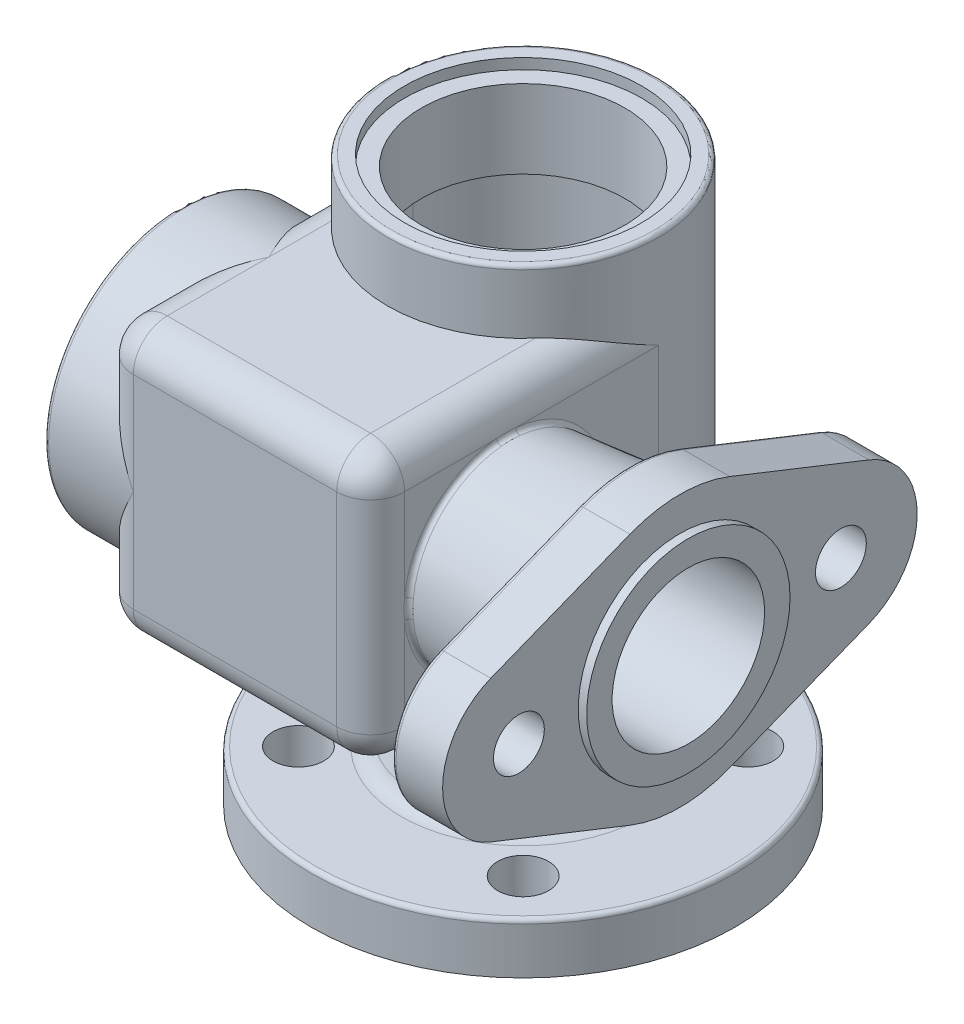
from build123d import *

# Parameters (mm, degrees)
EXTRUDE_1_REACH             = 169.693
EXTRUDE_1_END_RADIUS        = 32
SKETCH_2_W                  = 64
SKETCH_2_H                  = 64
EXTRUDE_1_DIRECTION_2_DEPTH = 32
FILLET_1_R                  = 8
FILLET_2_R                  = 8
SKETCH_4_R                  = 26
SKETCH_3_R                  = 23
EXTRUDE_2_DEPTH             = 12
SKETCH_6_R                  = 24
EXTRUDE_3_DEPTH             = 2
CUT_EXTRUDE_1_REACH         = 206.494
SKETCH_7_R                  = 6
SKETCH_8_R                  = 18
CUT_EXTRUDE_2_DEPTH         = 53
CUT_EXTRUDE_3_DEPTH         = 52
SKETCH_10_R                 = 28
CUT_EXTRUDE_4_DEPTH         = 2.5
CUT_EXTRUDE_5_REACH         = 179.891
SKETCH_11_R                 = 24
SKETCH_12_R                 = 12.5
CUT_EXTRUDE_6_DEPTH         = 39
SKETCH_13_R                 = 18
CUT_EXTRUDE_7_DEPTH         = 10
EXTRUDE_4_REACH             = 204.704
SKETCH_15_R                 = 32
SKETCH_16_R                 = 24
CUT_EXTRUDE_8_DEPTH         = 4
CUT_EXTRUDE_9_REACH         = 202.362
SKETCH_17_R                 = 19.5
SKETCH_18_R                 = 6
CUT_EXTRUDE_10_DEPTH        = 170.499262535
PATTERN_CIRCULAR_1_COUNT    = 4
FILLET_3_R                  = 1
FILLET_4_R                  = 1
CUT_EXTRUDE_11_REACH        = 141.348
SKETCH_19_R                 = 16.5


with BuildPart() as part:
    # 草圖1 → 旋轉1 (revolve)
    with BuildSketch(Plane.XY, mode=Mode.PRIVATE) as revolve_1_sk:
        with BuildLine():
            Line((0, 0), (30, 0))
            Line((30, 0), (30, 2))
            Line((30, 2), (50, 2))
            Line((50, 2), (50, 13))
            ThreePointArc((50, 13), (49.707106781, 13.707106781), (49, 14))
            Line((49, 14), (28.772001873, 14))
            ThreePointArc((28.772001873, 14), (26.493622522, 14.71229753), (25.026685162, 16.595506234))
            Line((25.026685162, 16.595506234), (20.973673426, 27.403537532))
            ThreePointArc((20.973673426, 27.403537532), (20.822133836, 29.710533915), (21.972435676, 31.716026931))
            ThreePointArc((21.972435676, 31.716026931), (29.386373897, 42.313460141), (32, 54.979991994))
            Line((32, 54.979991994), (32, 134))
            ThreePointArc((32, 134), (31.707106781, 134.707106781), (31, 135))
            Line((31, 135), (0, 135))
            Line((0, 135), (0, 0))
        make_face()
    revolve(revolve_1_sk.sketch.rotate(Axis((0, 0, 0), (0, 1, 0)), 90), axis=Axis((0, 0, 0), (0, 1, 0)))

    # 填料-伸長1: up to this cylinder (the profile starts outside it)
    extrude_1_end = Plane(origin=(0, 88, 0), z_dir=(0, -1, 0)) * Cylinder(EXTRUDE_1_END_RADIUS, 404.386, mode=Mode.PRIVATE)
    # 草圖2 → 填料-伸長1 (add, up to the surface)
    with BuildSketch(Plane.XY.offset(36), mode=Mode.PRIVATE) as extrude_1_sk1:
        with Locations((0, 88)):
            Rectangle(SKETCH_2_W, SKETCH_2_H)
    extrude_1_tool1 = extrude(extrude_1_sk1.sketch, amount=-EXTRUDE_1_REACH, mode=Mode.PRIVATE) - extrude_1_end
    add(extrude_1_tool1.solids().sort_by_distance((0, 88, 36))[0])

    # 草圖2 → 填料-伸長1 direction 2 (add)
    with BuildSketch(Plane.XY.offset(36)):
        with Locations((0, 88)):
            Rectangle(SKETCH_2_W, SKETCH_2_H)
    extrude(amount=EXTRUDE_1_DIRECTION_2_DEPTH)

    # 圓角1
    # the kernel refuses this fillet: 8 mm, written as the material it takes off along each edge
    with BuildSketch(Plane(origin=(-32, 120, -20), x_dir=(0, -1, 0), z_dir=(0, 0, 1))) as fillet_1_piece_1_section:
        with BuildLine():
            CenterArc((FILLET_1_R, FILLET_1_R), FILLET_1_R, 180, 90)
            Line((0, FILLET_1_R), (0, 0))
            Line((0, 0), (FILLET_1_R, 0))
        make_face()
    fillet_1_piece_1 = extrude(amount=108, mode=Mode.PRIVATE)
    fillet_1_piece_1 = fillet_1_piece_1 - Plane(origin=(0, 118.142292592, 0), x_dir=(0, 0, -1), z_dir=(0, 1, 0)) * Cylinder(32, 248, mode=Mode.PRIVATE)
    add(fillet_1_piece_1, mode=Mode.SUBTRACT)
    with BuildSketch(Plane(origin=(-32, 56, -20), x_dir=(1, 0, 0), z_dir=(0, 0, 1))) as fillet_1_piece_2_section:
        with BuildLine():
            CenterArc((FILLET_1_R, FILLET_1_R), FILLET_1_R, 180, 90)
            Line((0, FILLET_1_R), (0, 0))
            Line((0, 0), (FILLET_1_R, 0))
        make_face()
    fillet_1_piece_2 = extrude(amount=108, mode=Mode.PRIVATE)
    fillet_1_piece_2 = fillet_1_piece_2 - Plane(origin=(0, 57.85770728, 0), x_dir=(0, 0, -1), z_dir=(0, 1, 0)) * Cylinder(32, 248, mode=Mode.PRIVATE)
    add(fillet_1_piece_2, mode=Mode.SUBTRACT)
    with BuildSketch(Plane(origin=(32, 56, 88), x_dir=(-1, 0, 0), z_dir=(0, 0, -1))) as fillet_1_piece_3_section:
        with BuildLine():
            CenterArc((FILLET_1_R, FILLET_1_R), FILLET_1_R, 180, 90)
            Line((0, FILLET_1_R), (0, 0))
            Line((0, 0), (FILLET_1_R, 0))
        make_face()
    fillet_1_piece_3 = extrude(amount=108, mode=Mode.PRIVATE)
    fillet_1_piece_3 = fillet_1_piece_3 - Plane(origin=(0, 57.857708175, 0), x_dir=(0, 0, -1), z_dir=(0, 1, 0)) * Cylinder(32, 248, mode=Mode.PRIVATE)
    add(fillet_1_piece_3, mode=Mode.SUBTRACT)
    with BuildSketch(Plane(origin=(32, 120, -20), x_dir=(-1, 0, 0), z_dir=(0, 0, 1))) as fillet_1_piece_4_section:
        with BuildLine():
            CenterArc((FILLET_1_R, FILLET_1_R), FILLET_1_R, 180, 90)
            Line((0, FILLET_1_R), (0, 0))
            Line((0, 0), (FILLET_1_R, 0))
        make_face()
    fillet_1_piece_4 = extrude(amount=108, mode=Mode.PRIVATE)
    fillet_1_piece_4 = fillet_1_piece_4 - Plane(origin=(0, 118.142291825, 0), x_dir=(0, 0, -1), z_dir=(0, 1, 0)) * Cylinder(32, 248, mode=Mode.PRIVATE)
    add(fillet_1_piece_4, mode=Mode.SUBTRACT)

    # 圓角2
    fillet_2_edges = [part.edges().sort_by_distance(p)[0] for p in [
        (0, 56, 68),
        (-32, 88, 68),
        (32, 88, 68),
        (0, 120, 68),
        (-29.656854249, 117.656854249, 68),
        (29.656854249, 117.656854249, 68),
        (29.656854249, 58.343145751, 68),
        (-29.656854249, 58.343145751, 68),
    ]]
    fillet(fillet_2_edges, radius=FILLET_2_R)

    # 草圖4 → 疊層拉伸1 section 0
    with BuildSketch(Plane(origin=(61, 0, 0), x_dir=(0, 0, -1), z_dir=(1, 0, 0))):
        with Locations((-36, 88)):
            Circle(SKETCH_4_R)
    # 草圖3 → 疊層拉伸1 section 1
    with BuildSketch(Plane(origin=(32, 0, 0), x_dir=(0, 0, -1), z_dir=(1, 0, 0))):
        with Locations((-36, 88)):
            Circle(SKETCH_3_R)
    loft()

    # 草圖5 → 填料-伸長2 (add)
    with BuildSketch(Plane(origin=(61, 0, 0), x_dir=(0, 0, -1), z_dir=(1, 0, 0))):
        with BuildLine():
            Line((-80.631578947, 104.733862694), (-47.789473684, 117.749089234))
            ThreePointArc((-47.789473684, 117.749089234), (-36, 120), (-24.210526316, 117.749089234))
            Line((-24.210526316, 117.749089234), (8.631578947, 104.733862694))
            ThreePointArc((8.631578947, 104.733862694), (20, 88), (8.631578947, 71.266137306))
            Line((8.631578947, 71.266137306), (-24.210526316, 58.250910766))
            ThreePointArc((-24.210526316, 58.250910766), (-36, 56), (-47.789473684, 58.250910766))
            Line((-47.789473684, 58.250910766), (-80.631578947, 71.266137306))
            ThreePointArc((-80.631578947, 71.266137306), (-92, 88), (-80.631578947, 104.733862694))
        make_face()
    extrude(amount=EXTRUDE_2_DEPTH)

    # 草圖6 → 填料-伸長3 (add)
    with BuildSketch(Plane(origin=(73, 0, 0), x_dir=(0, 0, -1), z_dir=(1, 0, 0))):
        with Locations((-36, 88)):
            Circle(SKETCH_6_R)
    extrude(amount=EXTRUDE_3_DEPTH)

    # 草圖7 → 除料-伸長1 (cut, up to next)
    with BuildSketch(Plane(origin=(73, 0, 0), x_dir=(0, 0, -1), z_dir=(1, 0, 0)), mode=Mode.PRIVATE) as cut_extrude_1_sk1:
        with Locations((-74, 88)):
            Circle(SKETCH_7_R)
    cut_extrude_1_tool1 = extrude(cut_extrude_1_sk1.sketch, amount=-CUT_EXTRUDE_1_REACH, mode=Mode.PRIVATE) & part.part
    # 草圖7 → 除料-伸長1 (cut, up to next)
    with BuildSketch(Plane(origin=(73, 0, 0), x_dir=(0, 0, -1), z_dir=(1, 0, 0)), mode=Mode.PRIVATE) as cut_extrude_1_sk2:
        with Locations((2, 88)):
            Circle(SKETCH_7_R)
    cut_extrude_1_tool2 = extrude(cut_extrude_1_sk2.sketch, amount=-CUT_EXTRUDE_1_REACH, mode=Mode.PRIVATE) & part.part
    add(cut_extrude_1_tool1.solids().sort_by_distance((73, 88, 74))[0], mode=Mode.SUBTRACT)
    add(cut_extrude_1_tool2.solids().sort_by_distance((73, 88, -2))[0], mode=Mode.SUBTRACT)

    # 草圖8 → 除料-伸長2 (cut)
    with BuildSketch(Plane(origin=(75, 0, 0), x_dir=(0, 0, -1), z_dir=(1, 0, 0))):
        with Locations((-36, 88)):
            Circle(SKETCH_8_R)
    extrude(amount=-CUT_EXTRUDE_2_DEPTH, mode=Mode.SUBTRACT)

    # 草圖9 → 除料-伸長3 (cut)
    with BuildSketch(Plane(origin=(0, 62, 0), x_dir=(1, 0, 0), z_dir=(0, 1, 0))):
        with BuildLine():
            Line((26, 0), (26, -62))
            Line((26, -62), (-26, -62))
            Line((-26, -62), (-26, 0))
            ThreePointArc((-26, 0), (0, 26), (26, 0))
        make_face()
    extrude(amount=CUT_EXTRUDE_3_DEPTH, mode=Mode.SUBTRACT)

    # 草圖10 → 除料-伸長4 (cut)
    with BuildSketch(Plane(origin=(0, 135, 0), x_dir=(1, 0, 0), z_dir=(0, 1, 0))):
        with Locations(Location((0, 0, 0), (0, 0, 270))):
            Circle(SKETCH_10_R)
    extrude(amount=-CUT_EXTRUDE_4_DEPTH, mode=Mode.SUBTRACT)

    # 草圖11 → 除料-伸長5 (cut, up to next)
    with BuildSketch(Plane(origin=(0, 132.5, 0), x_dir=(1, 0, 0), z_dir=(0, 1, 0)), mode=Mode.PRIVATE) as cut_extrude_5_sk1:
        with Locations(Location((0, 0, 0), (0, 0, 270))):
            Circle(SKETCH_11_R)
    cut_extrude_5_tool1 = extrude(cut_extrude_5_sk1.sketch, amount=-CUT_EXTRUDE_5_REACH, mode=Mode.PRIVATE) & part.part
    add(cut_extrude_5_tool1.solids().sort_by_distance((0, 132.5, 0))[0], mode=Mode.SUBTRACT)

    # 草圖12 → 除料-伸長6 (cut)
    with BuildSketch(Plane.XZ):
        with Locations(Location((0, 0, 0), (0, 0, 270))):
            Circle(SKETCH_12_R)
    extrude(amount=-CUT_EXTRUDE_6_DEPTH, mode=Mode.SUBTRACT)

    # 草圖13 → 除料-伸長7 (cut)
    with BuildSketch(Plane.XZ.offset(-39)):
        with Locations(Location((0, 0, 0), (0, 0, 270))):
            Circle(SKETCH_13_R)
    extrude(amount=-CUT_EXTRUDE_7_DEPTH, mode=Mode.SUBTRACT)

    # 草圖15 → 填料-伸長4 (add, up to next)
    with BuildSketch(Plane(origin=(-45, 0, 0), x_dir=(0, 0, -1), z_dir=(1, 0, 0)), mode=Mode.PRIVATE) as extrude_4_sk1:
        with Locations(Location((-36, 88, 0), (0, 0, 180))):
            Circle(SKETCH_15_R)
    extrude_4_tool1 = extrude(extrude_4_sk1.sketch, amount=EXTRUDE_4_REACH, mode=Mode.PRIVATE) - part.part
    add(extrude_4_tool1.solids().sort_by_distance((-45, 88, 36))[0])

    # 草圖16 → 除料-伸長8 (cut)
    with BuildSketch(Plane.ZY.offset(45)):
        with Locations(Location((36, 88, 0), (0, 0, 180))):
            Circle(SKETCH_16_R)
    extrude(amount=-CUT_EXTRUDE_8_DEPTH, mode=Mode.SUBTRACT)

    # 草圖17 → 除料-伸長9 (cut, up to next)
    with BuildSketch(Plane.ZY.offset(41), mode=Mode.PRIVATE) as cut_extrude_9_sk1:
        with Locations((36, 88)):
            Circle(SKETCH_17_R)
    cut_extrude_9_tool1 = extrude(cut_extrude_9_sk1.sketch, amount=-CUT_EXTRUDE_9_REACH, mode=Mode.PRIVATE) & part.part
    add(cut_extrude_9_tool1.solids().sort_by_distance((-41, 88, 36))[0], mode=Mode.SUBTRACT)

    # 草圖18 → 除料-伸長10 (cut, through all)
    with BuildSketch(Plane(origin=(0, 14, 0), x_dir=(1, 0, 0), z_dir=(0, 1, 0))):
        with Locations(Location((26.516504294, 26.516504294, 0), (0, 0, 270))):
            Circle(SKETCH_18_R)
    cut_extrude_10 = extrude(amount=-CUT_EXTRUDE_10_DEPTH, mode=Mode.SUBTRACT)

    # 環狀複製排列1: 除料-伸長10 ×4 about axis
    pattern_circular_1_axis = Axis((0, 0, 0), (0, 1, 0))
    for i in range(1, PATTERN_CIRCULAR_1_COUNT):
        add(cut_extrude_10.rotate(pattern_circular_1_axis, i * 360 / PATTERN_CIRCULAR_1_COUNT), mode=Mode.SUBTRACT)

    # 圓角3
    fillet_3_edges = [part.edges().sort_by_distance(p)[0] for p in [
        (61, 88, 92),
        (61, 64.758524036, 64.210526316),
        (61, 56, 36),
        (61, 64.758524036, 7.789473684),
        (61, 88, -20),
        (61, 111.241475964, 7.789473684),
        (61, 120, 36),
        (61, 111.241475964, 64.210526316),
    ]]
    fillet(fillet_3_edges, radius=FILLET_3_R)

    # 圓角4
    # the kernel refuses this fillet: 1 mm, written as the material it adds along each edge
    with BuildSketch(Plane(origin=(61, 88, 36), x_dir=(0, 0, -1), z_dir=(0, -1, 0))) as fillet_4_piece_1:
        with BuildLine():
            CenterArc((26 + FILLET_4_R * 0.901888257732, -FILLET_4_R), FILLET_4_R, 90, 84.093858886)
            Line((26 - FILLET_4_R * 0.0928035360946, -FILLET_4_R * 0.897100848914), (26 - FILLET_4_R * 0.112697371971, -FILLET_4_R * 0.895042865893))
            Line((26 - FILLET_4_R * 0.112697371971, -FILLET_4_R * 0.895042865893), (26 - FILLET_4_R * 0.0180377651546, FILLET_4_R * 0.02))
            Line((26 - FILLET_4_R * 0.0180377651546, FILLET_4_R * 0.02), (26 + FILLET_4_R * 0.901888257732, FILLET_4_R * 0.02))
            Line((26 + FILLET_4_R * 0.901888257732, FILLET_4_R * 0.02), (26 + FILLET_4_R * 0.901888257732, 0))
        make_face()
    revolve(axis=Axis((61, 88, 36), (1, 0, 0)))
    with BuildSketch(Plane(origin=(32, 88, 36), x_dir=(0, 0, -1), z_dir=(0, -1, 0))) as fillet_4_piece_2:
        with BuildLine():
            CenterArc((23 + FILLET_4_R * 1.10878480946, FILLET_4_R), FILLET_4_R, 174.093858886, 95.906141114)
            Line((23 + FILLET_4_R * 1.10878480946, 0), (23 + FILLET_4_R * 1.10878480946, -FILLET_4_R * 0.02))
            Line((23 + FILLET_4_R * 1.10878480946, -FILLET_4_R * 0.02), (23 - FILLET_4_R * 0.0221756961891, -FILLET_4_R * 0.02))
            Line((23 - FILLET_4_R * 0.0221756961891, -FILLET_4_R * 0.02), (23 + FILLET_4_R * 0.094199179753, FILLET_4_R * 1.10495713411))
            Line((23 + FILLET_4_R * 0.094199179753, FILLET_4_R * 1.10495713411), (23 + FILLET_4_R * 0.11409301563, FILLET_4_R * 1.10289915109))
        make_face()
    revolve(axis=Axis((32, 88, 36), (1, 0, 0)))
    # the kernel refuses this fillet: 1 mm, written as the material it takes off along each edge
    with BuildSketch(Plane(origin=(-45, 88, 36), x_dir=(0, 0, 1), z_dir=(0, 1, 0))) as fillet_4_2_piece_1:
        with BuildLine():
            CenterArc((32 - FILLET_4_R, FILLET_4_R), FILLET_4_R, 270, 90)
            Line((32 - FILLET_4_R, 0), (32 - FILLET_4_R, -FILLET_4_R * 0.02))
            Line((32 - FILLET_4_R, -FILLET_4_R * 0.02), (32 + FILLET_4_R * 0.02, -FILLET_4_R * 0.02))
            Line((32 + FILLET_4_R * 0.02, -FILLET_4_R * 0.02), (32 + FILLET_4_R * 0.02, FILLET_4_R))
            Line((32 + FILLET_4_R * 0.02, FILLET_4_R), (32, FILLET_4_R))
        make_face()
    revolve(axis=Axis((-45, 88, 36), (1, 0, 0)), mode=Mode.SUBTRACT)

    # 草圖19 → 除料-伸長11 (cut, up to next)
    with BuildSketch(Plane(origin=(0, 62, 0), x_dir=(1, 0, 0), z_dir=(0, 1, 0)), mode=Mode.PRIVATE) as cut_extrude_11_sk1:
        with Locations(Location((0, 0, 0), (0, 0, 270))):
            Circle(SKETCH_19_R)
    cut_extrude_11_tool1 = extrude(cut_extrude_11_sk1.sketch, amount=-CUT_EXTRUDE_11_REACH, mode=Mode.PRIVATE) & part.part
    add(cut_extrude_11_tool1.solids().sort_by_distance((0, 62, 0))[0], mode=Mode.SUBTRACT)


solid = part.part
